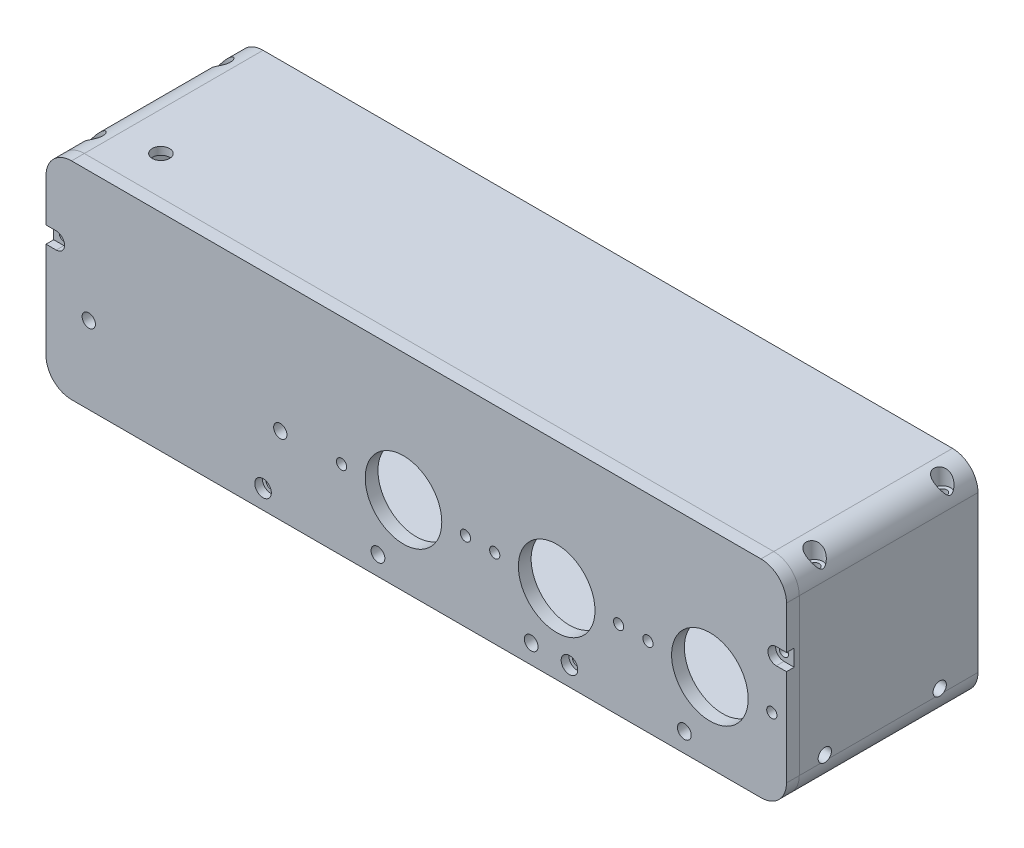
from build123d import *

# Parameters (mm, degrees)
SKETCH1_W                          = 290
SKETCH1_H                          = 100
BOSS_EXTRUDE1_DEPTH                = 5
F_1_0_30_DIAMETER_HOLE1_D          = 30
F_4_0_4_DIAMETER_HOLE1_D           = 4
F_5_2_START                        = -1
F_5_2_5_2_DIAMETER_HOLE1_OUTLINE_R = 2.6
F_5_2_5_2_DIAMETER_HOLE1_DEPTH     = 7
BOSS_EXTRUDE2_DEPTH                = 290
F_5_4_5_4_DIAMETER_HOLE1_D         = 5.4
SKETCH17_W                         = 65
SKETCH17_H                         = 58
BOSS_EXTRUDE4_DEPTH                = 8
SKETCH18_W                         = 65
SKETCH18_H                         = 58
BOSS_EXTRUDE5_DEPTH                = 8
SKETCH19_W                         = 30
SKETCH19_H                         = 30
CUT_EXTRUDE1_DEPTH                 = 290
FILLET2_R                          = 10
FILLET3_R                          = 5
FILLET4_R                          = 10
CBORE_FOR_M3_SHCS1_AT_2_COUNT      = 2
CBORE_FOR_M3_SHCS1_AT_2_PITCH      = 50
CBORE_FOR_M3_SHCS1_AT_3_COUNT      = 2
CBORE_FOR_M3_SHCS1_AT_3_PITCH      = 282
CBORE_FOR_M3_SHCS1_AT_4_COUNT      = 2
CBORE_FOR_M3_SHCS1_AT_4_PITCH      = 286.398324017
SKETCH25_W                         = 2
SKETCH25_H                         = 15
F_4_0_4_DIAMETER_HOLE2_AT_2_COUNT  = 2
F_4_0_4_DIAMETER_HOLE2_AT_2_PITCH  = 50
F_4_0_4_DIAMETER_HOLE2_AT_3_COUNT  = 2
F_4_0_4_DIAMETER_HOLE2_AT_3_PITCH  = 282
F_4_0_4_DIAMETER_HOLE2_AT_4_COUNT  = 2
F_4_0_4_DIAMETER_HOLE2_AT_4_PITCH  = 286.398324017
CUT_EXTRUDE2_DEPTH                 = 10
CUT_EXTRUDE2_DEPTH_BACK            = 10
SKETCH27_W                         = 80
SKETCH27_H                         = 20
FILLET5_START                      = 13.289105795
FILLET5_DEPTH                      = 9.041134205
FILLET5_START_2                    = 16
FILLET5_2_DEPTH                    = 5
FILLET5_START_3                    = -20
FILLET5_3_DEPTH                    = 10.0000001
FILLET5_START_4                    = 10.9999999
FILLET5_4_DEPTH                    = 15.0000001
CBORE_FOR_M3_SHCS2_AT_2_COUNT      = 2
CBORE_FOR_M3_SHCS2_AT_2_PITCH      = 282
CBORE_FOR_M3_SHCS2_AT_3_COUNT      = 2
CBORE_FOR_M3_SHCS2_AT_3_PITCH      = 91.941557524
CBORE_FOR_M3_SHCS2_AT_4_COUNT      = 2
CBORE_FOR_M3_SHCS2_AT_4_PITCH      = 205.653227546
MOVE_START                         = -15
MOVE_FACE1_OUTLINE_R               = 2.3
MOVE_FACE1_OUTLINE_R_2             = 1.8
MOVE_FACE1_DEPTH                   = 16
CUT_EXTRUDE3_DEPTH                 = 3
F_15_0_START                       = -70
F_15_0_15_DIAMETER_HOLE1_OUTLINE_R = 7.5
F_15_0_15_DIAMETER_HOLE1_DEPTH     = 5
SKETCH35_R                         = 2.5
CUT_EXTRUDE4_DEPTH                 = 5
F_4_0_START                        = 15
F_4_0_4_DIAMETER_HOLE3_OUTLINE_R   = 2
F_4_0_4_DIAMETER_HOLE3_DEPTH       = 7
F_6_8_START                        = 41
F_6_8_6_8_DIAMETER_HOLE1_OUTLINE_R = 3.4
F_6_8_6_8_DIAMETER_HOLE1_DEPTH     = 10
SKETCH44_W                         = 22
SKETCH44_H                         = 30
CUT_EXTRUDE5_DEPTH                 = 5
F_10_0_START                       = -145
F_10_0_10_DIAMETER_HOLE1_OUTLINE_R = 5
F_10_0_10_DIAMETER_HOLE1_DEPTH     = 8
F_5_2_START_2                      = -146
F_5_2_5_2_DIAMETER_HOLE2_OUTLINE_R = 2.6
F_5_2_5_2_DIAMETER_HOLE2_DEPTH     = 31


with BuildPart() as part:
    # Sketch1 → Boss-Extrude1 (new body)
    with BuildSketch(Plane.XY):
        Rectangle(SKETCH1_W, SKETCH1_H)
    extrude(amount=BOSS_EXTRUDE1_DEPTH)

    # Ø1.0 (30) Diameter Hole1 (through all)
    with Locations(Plane.XY.offset(5)):
        with Locations((-5, 0), (55, 0), (115, 0)):
            Hole(F_1_0_30_DIAMETER_HOLE1_D / 2)

    # Ø4.0 (4) Diameter Hole1 (through all)
    with Locations(Plane.XY.offset(5)):
        with Locations((-29.25, 0), (19.25, 0), (30.75, 0), (79.25, 0), (139.25, 0), (90.75, 0)):
            Hole(F_4_0_4_DIAMETER_HOLE1_D / 2)

    # Ø5.2 (5.2) Diameter Hole1: read off the stored shape, not the designer's step
    # Ø5.2 (5.2) Diameter Hole1 outline → Ø5.2 (5.2) Diameter Hole1 (cut)
    with BuildSketch(Plane.XY.offset(F_5_2_START)):
        with Locations((-53.25, -0.75)):
            Circle(F_5_2_5_2_DIAMETER_HOLE1_OUTLINE_R)
        with Locations((-128.25, -0.75)):
            Circle(F_5_2_5_2_DIAMETER_HOLE1_OUTLINE_R)
    extrude(amount=F_5_2_5_2_DIAMETER_HOLE1_DEPTH, mode=Mode.SUBTRACT)

    # Sketch11 → Boss-Extrude2 (add)
    with BuildSketch(Plane(origin=(145, 0, 0), x_dir=(0, 0, -1), z_dir=(1, 0, 0))):
        Polygon((0, 21), (65, 21), (65, 42), (0, 42), (0, 50), (70, 50), (70, -31), (25, -31), (25, -61), (20, -61), (20, -31), (0, -31), (0, -16), (65, -16), (65, 16), (0, 16), align=None)
    extrude(amount=-BOSS_EXTRUDE2_DEPTH)

    # Ø5.4 (5.4) Diameter Hole1 (through all)
    with Locations(Plane.XY.offset(5)):
        with Locations((105, -23.5), (45, -23.5), (-15, -23.5)):
            Hole(F_5_4_5_4_DIAMETER_HOLE1_D / 2)

    # Sketch17 → Boss-Extrude4 (add)
    with BuildSketch(Plane(origin=(145, 0, 0), x_dir=(0, 0, -1), z_dir=(1, 0, 0))):
        with Locations((32.5, 13)):
            Rectangle(SKETCH17_W, SKETCH17_H)
    extrude(amount=-BOSS_EXTRUDE4_DEPTH)

    # Sketch18 → Boss-Extrude5 (add)
    with BuildSketch(Plane.ZY.offset(145)):
        with Locations((-32.5, 13)):
            Rectangle(SKETCH18_W, SKETCH18_H)
    extrude(amount=-BOSS_EXTRUDE5_DEPTH)

    # Sketch19 → Cut-Extrude1 (cut)
    with BuildSketch(Plane.ZY.offset(145)):
        with Locations((-10, -46)):
            Rectangle(SKETCH19_W, SKETCH19_H)
    extrude(amount=-CUT_EXTRUDE1_DEPTH, mode=Mode.SUBTRACT)


with BuildPart() as body_2:
    # Split1: the piece on the far side of the plane
    add(part.part)
    split(bisect_by=Plane.XY, keep=Keep.BOTTOM)

    # Fillet2
    fillet2_edges = [body_2.edges().sort_by_distance(p)[0] for p in [
        (145, -31, -35),
        (-145, -31, -35),
        (-145, 50, -35),
        (145, 50, -35),
    ]]
    fillet(fillet2_edges, radius=FILLET2_R)

    # Fillet3
    fillet3_edges = [body_2.edges().sort_by_distance(p)[0] for p in [
        (-137, -16, -32.5),
        (-137, 42, -32.5),
        (-137, 21, -32.5),
        (137, -16, -32.5),
        (137, 42, -32.5),
        (137, 21, -32.5),
        (137, 16, -32.5),
        (-137, 16, -32.5),
    ]]
    fillet(fillet3_edges, radius=FILLET3_R)


with BuildPart() as part_1:
    add(part.part)

    # Split1
    split(bisect_by=Plane.XY, keep=Keep.TOP)

    # Fillet4
    fillet4_edges = [part_1.edges().sort_by_distance(p)[0] for p in [
        (-145, -31, 2.5),
        (-145, 50, 2.5),
        (145, 50, 2.5),
        (145, -31, 2.5),
    ]]
    fillet(fillet4_edges, radius=FILLET4_R)


with BuildPart() as body_3:
    # Split2: the piece on the far side of the plane
    add(body_2.part)
    split(bisect_by=Plane(origin=(0, 40, 0), x_dir=(-1, 0, 0), z_dir=(0, -1, 0)), keep=Keep.BOTTOM)


with BuildPart() as body_2_1:
    add(body_2.part)

    # Split2
    split(bisect_by=Plane(origin=(0, 40, 0), x_dir=(-1, 0, 0), z_dir=(0, -1, 0)), keep=Keep.TOP)


with BuildPart() as cbore_for_m3_shcs1_tool:
    # Sketch23 → CBORE for M3 SHCS1 (revolve)
    with BuildSketch(Plane(origin=(-141, 50, -60), x_dir=(0, 0, 1), z_dir=(1, 0, 0))):
        Polygon((0, 0), (0, 25), (1.8, 25), (1.8, 7), (3.25, 7), (3.25, 0), align=None)
    cbore_for_m3_shcs1 = revolve(axis=Axis((-141, 56.35, -60), (0, -1, 0)))


with BuildPart() as body_2_2:
    add(body_2_1.part)

    # CBORE for M3 SHCS1: cut by cbore_for_m3_shcs1_tool
    add(cbore_for_m3_shcs1_tool.part, mode=Mode.SUBTRACT)


with BuildPart() as body_3_1:
    add(body_3.part)

    # CBORE for M3 SHCS1: cut by cbore_for_m3_shcs1_tool
    add(cbore_for_m3_shcs1_tool.part, mode=Mode.SUBTRACT)


with BuildPart() as cbore_for_m3_shcs1_at_2_tool:
    # CBORE for M3 SHCS1 at 2: CBORE for M3 SHCS1 ×2
    with Locations(*[(0, 0, i * CBORE_FOR_M3_SHCS1_AT_2_PITCH) for i in range(1, CBORE_FOR_M3_SHCS1_AT_2_COUNT)]):
        add(cbore_for_m3_shcs1)


with BuildPart() as body_2_3:
    add(body_2_2.part)

    # CBORE for M3 SHCS1 at 2: cut by cbore_for_m3_shcs1_at_2_tool
    add(cbore_for_m3_shcs1_at_2_tool.part, mode=Mode.SUBTRACT)


with BuildPart() as body_3_2:
    add(body_3_1.part)

    # CBORE for M3 SHCS1 at 2: cut by cbore_for_m3_shcs1_at_2_tool
    add(cbore_for_m3_shcs1_at_2_tool.part, mode=Mode.SUBTRACT)


with BuildPart() as cbore_for_m3_shcs1_at_3_tool:
    # CBORE for M3 SHCS1 at 3: CBORE for M3 SHCS1 ×2
    with Locations(*[(i * CBORE_FOR_M3_SHCS1_AT_3_PITCH, 0, 0) for i in range(1, CBORE_FOR_M3_SHCS1_AT_3_COUNT)]):
        add(cbore_for_m3_shcs1)


with BuildPart() as body_2_4:
    add(body_2_3.part)

    # CBORE for M3 SHCS1 at 3: cut by cbore_for_m3_shcs1_at_3_tool
    add(cbore_for_m3_shcs1_at_3_tool.part, mode=Mode.SUBTRACT)


with BuildPart() as body_3_3:
    add(body_3_2.part)

    # CBORE for M3 SHCS1 at 3: cut by cbore_for_m3_shcs1_at_3_tool
    add(cbore_for_m3_shcs1_at_3_tool.part, mode=Mode.SUBTRACT)


with BuildPart() as cbore_for_m3_shcs1_at_4_tool:
    # CBORE for M3 SHCS1 at 4: CBORE for M3 SHCS1 ×2
    with Locations(*[Vector(0.9846426335330976, 0, 0.17458202722218044) * (i * CBORE_FOR_M3_SHCS1_AT_4_PITCH) for i in range(1, CBORE_FOR_M3_SHCS1_AT_4_COUNT)]):
        add(cbore_for_m3_shcs1)


with BuildPart() as body_2_5:
    add(body_2_4.part)

    # CBORE for M3 SHCS1 at 4: cut by cbore_for_m3_shcs1_at_4_tool
    add(cbore_for_m3_shcs1_at_4_tool.part, mode=Mode.SUBTRACT)

    # Sketch25 → Ø4.0 (4) Diameter Hole2 (revolve, cut)
    with BuildSketch(Plane(origin=(141, 40, -10), x_dir=(0, 0, 1), z_dir=(1, 0, 0))):
        with Locations((1, 7.5)):
            Rectangle(SKETCH25_W, SKETCH25_H)
    f_4_0_4_diameter_hole2 = revolve(axis=Axis((141, 46.35, -10), (0, -1, 0)), mode=Mode.SUBTRACT)

    # Ø4.0 (4) Diameter Hole2 at 2: Ø4.0 (4) Diameter Hole2 ×2
    with Locations(*[(0, 0, -i * F_4_0_4_DIAMETER_HOLE2_AT_2_PITCH) for i in range(1, F_4_0_4_DIAMETER_HOLE2_AT_2_COUNT)]):
        add(f_4_0_4_diameter_hole2, mode=Mode.SUBTRACT)

    # Ø4.0 (4) Diameter Hole2 at 3: Ø4.0 (4) Diameter Hole2 ×2
    with Locations(*[(-i * F_4_0_4_DIAMETER_HOLE2_AT_3_PITCH, 0, 0) for i in range(1, F_4_0_4_DIAMETER_HOLE2_AT_3_COUNT)]):
        add(f_4_0_4_diameter_hole2, mode=Mode.SUBTRACT)

    # Ø4.0 (4) Diameter Hole2 at 4: Ø4.0 (4) Diameter Hole2 ×2
    with Locations(*[Vector(-0.9846426335330976, 0, -0.17458202722218044) * (i * F_4_0_4_DIAMETER_HOLE2_AT_4_PITCH) for i in range(1, F_4_0_4_DIAMETER_HOLE2_AT_4_COUNT)]):
        add(f_4_0_4_diameter_hole2, mode=Mode.SUBTRACT)

    # Sketch27 → Cut-Extrude2 (cut, two sides: drawn at the far end of the back side and taken through both)
    with BuildSketch(Plane(origin=(0, 21, 0), x_dir=(1, 0, 0), z_dir=(0, 1, 0)).offset(-CUT_EXTRUDE2_DEPTH_BACK)):
        with BuildLine():
            Line((57.5, 65), (122.5, 65))
            ThreePointArc((122.5, 65), (126, 61.5), (122.5, 58))
            Line((122.5, 58), (57.5, 58))
            ThreePointArc((57.5, 58), (54, 61.5), (57.5, 65))
        make_face()
        with Locations((-97, 10)):
            Rectangle(SKETCH27_W, SKETCH27_H)
    extrude(amount=CUT_EXTRUDE2_DEPTH + CUT_EXTRUDE2_DEPTH_BACK, mode=Mode.SUBTRACT)

    # Fillet5: read off the stored shape, not the designer's step
    # Fillet5 outline → Fillet5 (cut)
    with BuildSketch(Plane(origin=(0, 0, 0), x_dir=(1, 0, 0), z_dir=(0, 1, 0)).offset(FILLET5_START)):
        with BuildLine():
            Line((-57, 0), (-47, 0))
            ThreePointArc((-47, 0), (-54.071067812, 2.928932188), (-57, 10))
            Line((-57, 10), (-57, 0))
        make_face()
    extrude(amount=FILLET5_DEPTH, mode=Mode.SUBTRACT)

    # Fillet5 2 outline → Fillet5 2 (add)
    with BuildSketch(Plane(origin=(0, 0, 0), x_dir=(1, 0, 0), z_dir=(0, 1, 0)).offset(FILLET5_START_2)):
        with BuildLine():
            ThreePointArc((-67, 20), (-59.928932188, 17.071067812), (-57, 10))
            Line((-57, 10), (-57, 20))
            Line((-57, 20), (-67, 20))
        make_face()
        with BuildLine():
            ThreePointArc((-137, 10), (-134.071067812, 17.071067812), (-127, 20))
            Line((-127, 20), (-137, 20))
            Line((-137, 20), (-137, 10))
        make_face()
    extrude(amount=FILLET5_2_DEPTH)

    # Fillet5 3 outline → Fillet5 3 (add)
    with BuildSketch(Plane.XY.offset(FILLET5_START_3)):
        with BuildLine():
            Line((-137, 16), (-137, 11))
            ThreePointArc((-137, 11), (-135.535533906, 14.535533906), (-132, 16))
            Line((-132, 16), (-137, 16))
        make_face()
        with BuildLine():
            Line((-137, 26), (-137, 21))
            Line((-137, 21), (-132, 21))
            ThreePointArc((-132, 21), (-135.535533906, 22.464466094), (-137, 26))
        make_face()
    extrude(amount=FILLET5_3_DEPTH)

    # Fillet5 4 outline → Fillet5 4 (cut)
    with BuildSketch(Plane(origin=(0, 0, 0), x_dir=(1, 0, 0), z_dir=(0, 1, 0)).offset(FILLET5_START_4)):
        with BuildLine():
            Line((-132, 9.9999999), (-132, 18.660254038))
            ThreePointArc((-132, 18.660254038), (-135.660254038, 15), (-137, 10))
            Line((-137, 10), (-132, 9.9999999))
        make_face()
    extrude(amount=FILLET5_4_DEPTH, mode=Mode.SUBTRACT)


with BuildPart() as body_3_4:
    add(body_3_3.part)

    # CBORE for M3 SHCS1 at 4: cut by cbore_for_m3_shcs1_at_4_tool
    add(cbore_for_m3_shcs1_at_4_tool.part, mode=Mode.SUBTRACT)

    # Ø6.8 (6.8) Diameter Hole1: read off the stored shape, not the designer's step
    # Ø6.8 (6.8) Diameter Hole1 outline → Ø6.8 (6.8) Diameter Hole1 (cut)
    with BuildSketch(Plane(origin=(0, 0, 0), x_dir=(1, 0, 0), z_dir=(0, 1, 0)).offset(F_6_8_START)):
        with Locations((-120, 15)):
            Circle(F_6_8_6_8_DIAMETER_HOLE1_OUTLINE_R)
    extrude(amount=F_6_8_6_8_DIAMETER_HOLE1_DEPTH, mode=Mode.SUBTRACT)

    # Sketch44 → Cut-Extrude5 (cut)
    with BuildSketch(Plane.XZ.offset(-42)):
        with Locations((-120, -15)):
            Rectangle(SKETCH44_W, SKETCH44_H)
    extrude(amount=-CUT_EXTRUDE5_DEPTH, mode=Mode.SUBTRACT)


with BuildPart() as cbore_for_m3_shcs2_tool:
    # Sketch29 → CBORE for M3 SHCS2 (revolve)
    with BuildSketch(Plane(origin=(-141, 20, 5), x_dir=(0, -1, 0), z_dir=(1, 0, 0))):
        Polygon((0, 0), (0, 20), (1.8, 20), (1.8, 3), (3.25, 3), (3.25, 0), align=None)
    cbore_for_m3_shcs2 = revolve(axis=Axis((-141, 20, 11.35), (0, 0, -1)))


with BuildPart() as part_2:
    add(part_1.part)

    # CBORE for M3 SHCS2: cut by cbore_for_m3_shcs2_tool
    add(cbore_for_m3_shcs2_tool.part, mode=Mode.SUBTRACT)


with BuildPart() as body_2_6:
    add(body_2_5.part)

    # CBORE for M3 SHCS2: cut by cbore_for_m3_shcs2_tool
    add(cbore_for_m3_shcs2_tool.part, mode=Mode.SUBTRACT)


with BuildPart() as cbore_for_m3_shcs2_at_2_tool:
    # CBORE for M3 SHCS2 at 2: CBORE for M3 SHCS2 ×2
    with Locations(*[(i * CBORE_FOR_M3_SHCS2_AT_2_PITCH, 0, 0) for i in range(1, CBORE_FOR_M3_SHCS2_AT_2_COUNT)]):
        add(cbore_for_m3_shcs2)


with BuildPart() as part_3:
    add(part_2.part)

    # CBORE for M3 SHCS2 at 2: cut by cbore_for_m3_shcs2_at_2_tool
    add(cbore_for_m3_shcs2_at_2_tool.part, mode=Mode.SUBTRACT)


with BuildPart() as body_2_7:
    add(body_2_6.part)

    # CBORE for M3 SHCS2 at 2: cut by cbore_for_m3_shcs2_at_2_tool
    add(cbore_for_m3_shcs2_at_2_tool.part, mode=Mode.SUBTRACT)


with BuildPart() as cbore_for_m3_shcs2_at_3_tool:
    # CBORE for M3 SHCS2 at 3: CBORE for M3 SHCS2 ×2
    with Locations(*[Vector(0.8809944292988933, -0.47312663795681337, 0) * (i * CBORE_FOR_M3_SHCS2_AT_3_PITCH) for i in range(1, CBORE_FOR_M3_SHCS2_AT_3_COUNT)]):
        add(cbore_for_m3_shcs2)


with BuildPart() as part_4:
    add(part_3.part)

    # CBORE for M3 SHCS2 at 3: cut by cbore_for_m3_shcs2_at_3_tool
    add(cbore_for_m3_shcs2_at_3_tool.part, mode=Mode.SUBTRACT)


with BuildPart() as body_2_8:
    add(body_2_7.part)

    # CBORE for M3 SHCS2 at 3: cut by cbore_for_m3_shcs2_at_3_tool
    add(cbore_for_m3_shcs2_at_3_tool.part, mode=Mode.SUBTRACT)


with BuildPart() as cbore_for_m3_shcs2_at_4_tool:
    # CBORE for M3 SHCS2 at 4: CBORE for M3 SHCS2 ×2
    with Locations(*[Vector(0.9773734280695751, -0.21152111502998283, 0) * (i * CBORE_FOR_M3_SHCS2_AT_4_PITCH) for i in range(1, CBORE_FOR_M3_SHCS2_AT_4_COUNT)]):
        add(cbore_for_m3_shcs2)


with BuildPart() as part_5:
    add(part_4.part)

    # CBORE for M3 SHCS2 at 4: cut by cbore_for_m3_shcs2_at_4_tool
    add(cbore_for_m3_shcs2_at_4_tool.part, mode=Mode.SUBTRACT)

    # Sketch31 → Cut-Extrude3 (cut)
    with BuildSketch(Plane.XY.offset(5)):
        with BuildLine():
            Line((-141, 23.25), (-145, 23.25))
            Line((-145, 23.25), (-145, 16.75))
            Line((-145, 16.75), (-141, 16.75))
            ThreePointArc((-141, 16.75), (-137.75, 20), (-141, 23.25))
        make_face()
        with BuildLine():
            Line((141, 23.25), (145, 23.25))
            Line((145, 23.25), (145, 16.75))
            Line((145, 16.75), (141, 16.75))
            ThreePointArc((141, 16.75), (137.75, 20), (141, 23.25))
        make_face()
    extrude(amount=-CUT_EXTRUDE3_DEPTH, mode=Mode.SUBTRACT)


with BuildPart() as body_2_9:
    add(body_2_8.part)

    # CBORE for M3 SHCS2 at 4: cut by cbore_for_m3_shcs2_at_4_tool
    add(cbore_for_m3_shcs2_at_4_tool.part, mode=Mode.SUBTRACT)

    # Move Face1: read off the stored shape, not the designer's step
    # Move Face1 outline → Move Face1 (cut)
    # profile 1 of 4: a face of its own
    with BuildSketch(Plane.XY.offset(MOVE_START)):
        with Locations((60, -23.5)):
            Circle(MOVE_FACE1_OUTLINE_R)
        with Locations((60, -23.5)):
            Circle(MOVE_FACE1_OUTLINE_R_2, mode=Mode.SUBTRACT)
    # profile 2 of 4: a face of its own
    with BuildSketch(Plane.XY.offset(MOVE_START)):
        with Locations((-60, -23.5)):
            Circle(MOVE_FACE1_OUTLINE_R)
        with Locations((-60, -23.5)):
            Circle(MOVE_FACE1_OUTLINE_R_2, mode=Mode.SUBTRACT)
    # profile 3 of 4: a face of its own
    with BuildSketch(Plane.XY.offset(MOVE_START)):
        with Locations((141, 20)):
            Circle(MOVE_FACE1_OUTLINE_R)
        with Locations((141, 20)):
            Circle(MOVE_FACE1_OUTLINE_R_2, mode=Mode.SUBTRACT)
    # profile 4 of 4: a face of its own
    with BuildSketch(Plane.XY.offset(MOVE_START)):
        with Locations((-141, 20)):
            Circle(MOVE_FACE1_OUTLINE_R)
        with Locations((-141, 20)):
            Circle(MOVE_FACE1_OUTLINE_R_2, mode=Mode.SUBTRACT)
    extrude(amount=MOVE_FACE1_DEPTH, mode=Mode.SUBTRACT)

    # Ø15.0 (15) Diameter Hole1: read off the stored shape, not the designer's step
    # Ø15.0 (15) Diameter Hole1 outline → Ø15.0 (15) Diameter Hole1 (cut)
    with BuildSketch(Plane.XY.offset(F_15_0_START)):
        with Locations((0.5, 28.5)):
            Circle(F_15_0_15_DIAMETER_HOLE1_OUTLINE_R)
        with Locations((35.5, 28.5)):
            Circle(F_15_0_15_DIAMETER_HOLE1_OUTLINE_R)
    extrude(amount=F_15_0_15_DIAMETER_HOLE1_DEPTH, mode=Mode.SUBTRACT)

    # Sketch35 → Cut-Extrude4 (cut)
    with BuildSketch(Plane(origin=(0, 0, -70), x_dir=(-1, 0, 0), z_dir=(0, 0, -1))):
        with Locations((24.5, 28.5)):
            Circle(SKETCH35_R)
        with BuildLine():
            Line((-43, 28.5), (-43, 40))
            Line((-43, 40), (-28, 40))
            Line((-28, 40), (-28, 28.5))
            ThreePointArc((-28, 28.5), (-35.5, 36), (-43, 28.5))
        make_face()
        with BuildLine():
            Line((-8, 28.5), (-8, 40))
            Line((-8, 40), (7, 40))
            Line((7, 40), (7, 28.5))
            ThreePointArc((7, 28.5), (-0.5, 36), (-8, 28.5))
        make_face()
    extrude(amount=-CUT_EXTRUDE4_DEPTH, mode=Mode.SUBTRACT)

    # Ø4.0 (4) Diameter Hole3: read off the stored shape, not the designer's step
    # Ø4.0 (4) Diameter Hole3 outline → Ø4.0 (4) Diameter Hole3 (cut)
    with BuildSketch(Plane(origin=(0, 0, 0), x_dir=(1, 0, 0), z_dir=(0, 1, 0)).offset(F_4_0_START)):
        with Locations((-40.5, 50)):
            Circle(F_4_0_4_DIAMETER_HOLE3_OUTLINE_R)
        with Locations((125, 49.5)):
            Circle(F_4_0_4_DIAMETER_HOLE3_OUTLINE_R)
        with Locations((57.5, 5)):
            Circle(F_4_0_4_DIAMETER_HOLE3_OUTLINE_R)
        with Locations((125, 5)):
            Circle(F_4_0_4_DIAMETER_HOLE3_OUTLINE_R)
        with Locations((57.5, 49.5)):
            Circle(F_4_0_4_DIAMETER_HOLE3_OUTLINE_R)
        with Locations((46.5, 55)):
            Circle(F_4_0_4_DIAMETER_HOLE3_OUTLINE_R)
        with Locations((24.5, 17)):
            Circle(F_4_0_4_DIAMETER_HOLE3_OUTLINE_R)
        with Locations((46.5, 17)):
            Circle(F_4_0_4_DIAMETER_HOLE3_OUTLINE_R)
        with Locations((24.5, 55)):
            Circle(F_4_0_4_DIAMETER_HOLE3_OUTLINE_R)
        with Locations((11.5, 17)):
            Circle(F_4_0_4_DIAMETER_HOLE3_OUTLINE_R)
        with Locations((-10.5, 55)):
            Circle(F_4_0_4_DIAMETER_HOLE3_OUTLINE_R)
        with Locations((11.5, 55)):
            Circle(F_4_0_4_DIAMETER_HOLE3_OUTLINE_R)
        with Locations((-10.5, 17)):
            Circle(F_4_0_4_DIAMETER_HOLE3_OUTLINE_R)
    extrude(amount=F_4_0_4_DIAMETER_HOLE3_DEPTH, mode=Mode.SUBTRACT)

    # Ø10.0 (10) Diameter Hole1: read off the stored shape, not the designer's step
    # Ø10.0 (10) Diameter Hole1 outline → Ø10.0 (10) Diameter Hole1 (cut)
    with BuildSketch(Plane.YZ.offset(F_10_0_START)):
        with Locations((31.5, -50)):
            Circle(F_10_0_10_DIAMETER_HOLE1_OUTLINE_R)
    extrude(amount=F_10_0_10_DIAMETER_HOLE1_DEPTH, mode=Mode.SUBTRACT)

    # Ø5.2 (5.2) Diameter Hole2: read off the stored shape, not the designer's step
    # Ø5.2 (5.2) Diameter Hole2 outline → Ø5.2 (5.2) Diameter Hole2 (cut)
    with BuildSketch(Plane.YZ.offset(F_5_2_START_2)):
        with Locations((-19, -10)):
            Circle(F_5_2_5_2_DIAMETER_HOLE2_OUTLINE_R)
        with Locations((-19, -55)):
            Circle(F_5_2_5_2_DIAMETER_HOLE2_OUTLINE_R)
    f_5_2_5_2_diameter_hole2 = extrude(amount=F_5_2_5_2_DIAMETER_HOLE2_DEPTH, mode=Mode.SUBTRACT)

    # Mirror1: Ø5.2 (5.2) Diameter Hole2 across plane
    add(f_5_2_5_2_diameter_hole2.mirror(Plane(origin=(0, 0, 0), x_dir=(0, 0, 1), z_dir=(1, 0, 0))), mode=Mode.SUBTRACT)


solid = Compound([body_3_4.part, part_5.part, body_2_9.part])
